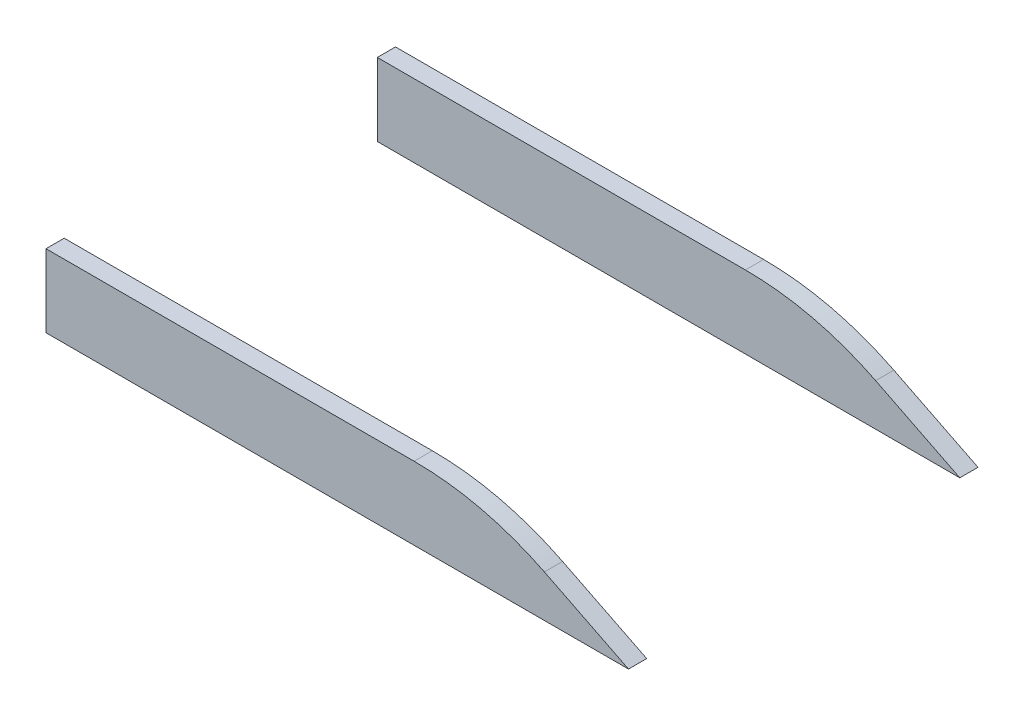
from build123d import *

# Parameters (mm, degrees)
BOSS_EXTRUDE1_START = 91
BOSS_EXTRUDE1_DEPTH = 5
BOSS_EXTRUDE2_DEPTH = 5


with BuildPart() as part:
    # Sketch2 → Boss-Extrude1 (new body)
    with BuildSketch(Plane.XY.offset(BOSS_EXTRUDE1_START)):
        with BuildLine():
            Line((0, 0), (0, -20))
            Line((0, -20), (160, -20))
            Line((160, -20), (136.89164944, -8.44582472))
            ThreePointArc((136.89164944, -8.44582472), (119.494795444, -2.140080843), (101.1145618, 0))
            Line((101.1145618, 0), (0, 0))
        make_face()
    extrude(amount=BOSS_EXTRUDE1_DEPTH)


with BuildPart() as body_2:
    # Sketch2<2> → Boss-Extrude2 (new body)
    with BuildSketch(Plane.XY):
        with BuildLine():
            Line((0, 0), (0, -20))
            Line((0, -20), (160, -20))
            Line((160, -20), (136.89164944, -8.44582472))
            ThreePointArc((136.89164944, -8.44582472), (119.494795444, -2.140080843), (101.1145618, 0))
            Line((101.1145618, 0), (0, 0))
        make_face()
    extrude(amount=BOSS_EXTRUDE2_DEPTH)


solid = Compound([part.part, body_2.part])
